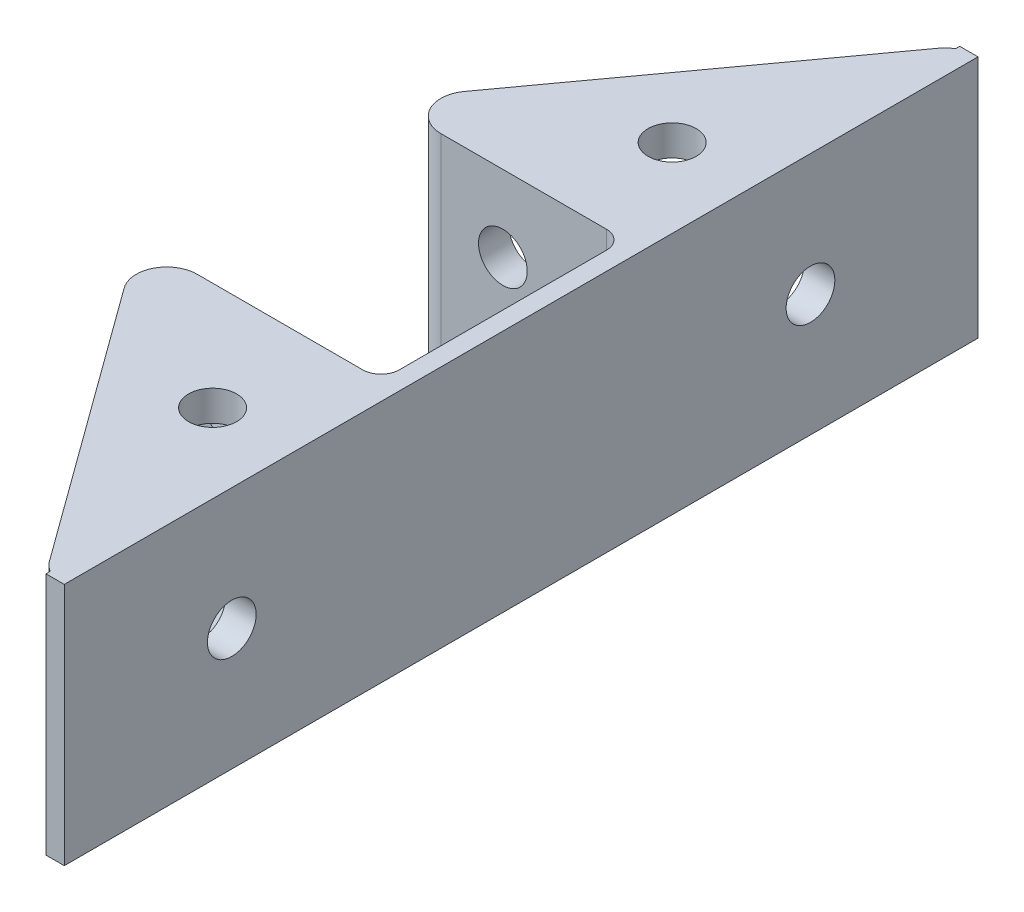
from build123d import *

# Parameters (mm, degrees)
SKETCH2_W                 = 150
SKETCH2_H                 = 40
BOSS_EXTRUDE1_DEPTH       = 3
BOSS_EXTRUDE2_DEPTH       = 40
SHELL3_T                  = -5
FILLET2_R                 = 5
F_8_0MM_DOWEL_HOLE1_D     = 8
F_8_0MM_DOWEL_HOLE2_D     = 8
F_8_0MM_DOWEL_HOLE2_DEPTH = 5
F_8_0MM_DOWEL_HOLE2_TIP   = 2.403442476
CUT_EXTRUDE1_REACH        = 105.822
SKETCH8_R                 = 3.95
FILLET3_R                 = 3
CUT_EXTRUDE2_REACH        = 110.916
SKETCH9_R                 = 4


with BuildPart() as part:
    # Sketch2 → Boss-Extrude1 (new body)
    with BuildSketch(Plane.ZY.offset(-23)):
        with Locations((-20, 20)):
            Rectangle(SKETCH2_W, SKETCH2_H)
    extrude(amount=BOSS_EXTRUDE1_DEPTH)

    # Sketch3 → Boss-Extrude2 (add)
    with BuildSketch(Plane.XZ):
        Polygon((20, 55), (-20, 0), (20, 0), align=None)
    extrude(amount=-BOSS_EXTRUDE2_DEPTH)

    # Shell3
    shell3_openings = [part.faces().sort_by_distance(p)[0] for p in [
        (0, 20, 27.5),
    ]]
    offset(amount=SHELL3_T, openings=shell3_openings, kind=Kind.INTERSECTION)

    # Fillet2
    # the kernel refuses this fillet: 5 mm, written as the material it takes off along each edge
    with BuildSketch(Plane(origin=(20, -6.365307396, 55), x_dir=(1, 0, 0), z_dir=(0, 1, 0))) as fillet2_piece_1:
        with BuildLine():
            CenterArc((FILLET2_R * 0.509224591703, FILLET2_R), FILLET2_R, 216.027373385, 53.972626615)
            Line((-FILLET2_R * 0.2995114926, FILLET2_R * 0.411828302325), (0, 0))
            Line((0, 0), (FILLET2_R * 0.509224591703, 0))
        make_face()
    extrude(amount=52.730614793, mode=Mode.SUBTRACT)
    with BuildSketch(Plane(origin=(-20, -24.547125578, 0), x_dir=(1, 0, 0), z_dir=(0, 1, 0))) as fillet2_piece_2:
        with BuildLine():
            CenterArc((FILLET2_R * 1.96377004625, -FILLET2_R), FILLET2_R, 90, 126.027373385)
            Line((FILLET2_R * 1.15503396195, -FILLET2_R * 1.58817169768), (0, 0))
            Line((0, 0), (FILLET2_R * 1.96377004625, 0))
        make_face()
    extrude(amount=89.094251156, mode=Mode.SUBTRACT)

    # Ø8.0mm Dowel Hole1 (through all)
    with Locations(Plane.XY.offset(5)):
        with Locations((0, 12.5), (0, 27.5)):
            Hole(F_8_0MM_DOWEL_HOLE1_D / 2)

    # Ø8.0mm Dowel Hole2
    with Locations(Plane.ZY.offset(-18)):
        with Locations((27.5, 20)):
            Hole(F_8_0MM_DOWEL_HOLE2_D / 2, depth=F_8_0MM_DOWEL_HOLE2_DEPTH)
            with Locations((0, 0, -(F_8_0MM_DOWEL_HOLE2_DEPTH + F_8_0MM_DOWEL_HOLE2_TIP / 2))):  # 118° drill point
                Cone(0, F_8_0MM_DOWEL_HOLE2_D / 2, F_8_0MM_DOWEL_HOLE2_TIP, mode=Mode.SUBTRACT)

    # Sketch8 → Cut-Extrude1 (cut, up to next)
    with BuildSketch(Plane.XZ.offset(-35), mode=Mode.PRIVATE) as cut_extrude1_sk1:
        with Locations(Location((10.069403087, 17.720429244, 0), (0, 0, 270))):
            Circle(SKETCH8_R)
    cut_extrude1_tool1 = extrude(cut_extrude1_sk1.sketch, amount=-CUT_EXTRUDE1_REACH, mode=Mode.PRIVATE) & part.part
    add(cut_extrude1_tool1.solids().sort_by_distance((10.069403, 35, 17.720429))[0], mode=Mode.SUBTRACT)

    # Mirror2: part across plane


with BuildPart() as part_1:
    add(part.part)
    add(part.part.mirror(Plane.XY.offset(-20)))

    # Fillet3
    fillet3_edges = [part_1.edges().sort_by_distance(p)[0] for p in [
        (20, 20, 0),
        (20, 20, -40),
    ]]
    fillet(fillet3_edges, radius=FILLET3_R)

    # Sketch9 → Cut-Extrude2 (cut, up to next)
    with BuildSketch(Plane.ZY.offset(-20), mode=Mode.PRIVATE) as cut_extrude2_sk1:
        with Locations((27.5, 20)):
            Circle(SKETCH9_R)
    cut_extrude2_tool1 = extrude(cut_extrude2_sk1.sketch, amount=-CUT_EXTRUDE2_REACH, mode=Mode.PRIVATE) & part_1.part
    # Sketch9 → Cut-Extrude2 (cut, up to next)
    with BuildSketch(Plane.ZY.offset(-20), mode=Mode.PRIVATE) as cut_extrude2_sk2:
        with Locations(Location((-67.5, 20, 0), (0, 0, 180))):
            Circle(SKETCH9_R)
    cut_extrude2_tool2 = extrude(cut_extrude2_sk2.sketch, amount=-CUT_EXTRUDE2_REACH, mode=Mode.PRIVATE) & part_1.part
    add(cut_extrude2_tool1.solids().sort_by_distance((20, 20, 27.5))[0], mode=Mode.SUBTRACT)
    add(cut_extrude2_tool2.solids().sort_by_distance((20, 20, -67.5))[0], mode=Mode.SUBTRACT)


solid = part_1.part
